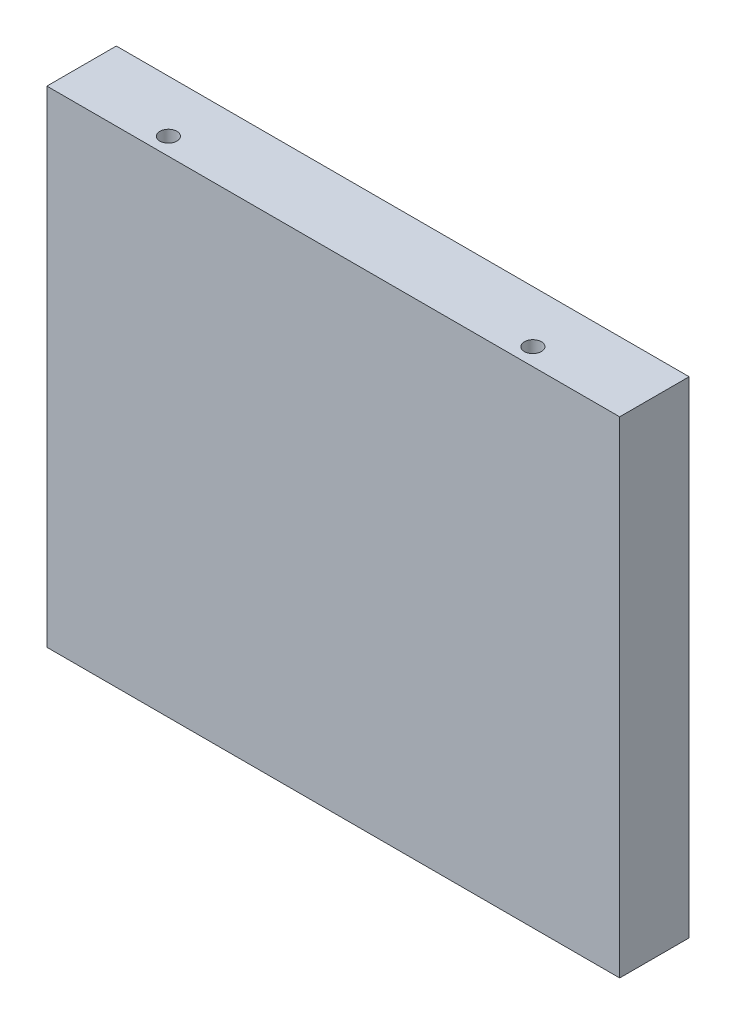
from build123d import *

# Parameters (mm, degrees)
SKETCH1_W              = 838.2
SKETCH1_H              = 711.2
BOSS_EXTRUDE1_DEPTH    = 101.6
F_25_0MM_DOWEL_HOLE1_D = 25


with BuildPart() as part:
    # Sketch1 → Boss-Extrude1 (new body)
    with BuildSketch(Plane.XY):
        Rectangle(SKETCH1_W, SKETCH1_H)
    extrude(amount=BOSS_EXTRUDE1_DEPTH)

    # Ø25.0mm Dowel Hole1 (through all)
    with Locations(Plane(origin=(0, -355.6, 0), x_dir=(-1, 0, 0), z_dir=(0, -1, 0))):
        with Locations((266.7, -76.2), (-266.7, -76.2)):
            Hole(F_25_0MM_DOWEL_HOLE1_D / 2)


solid = part.part
